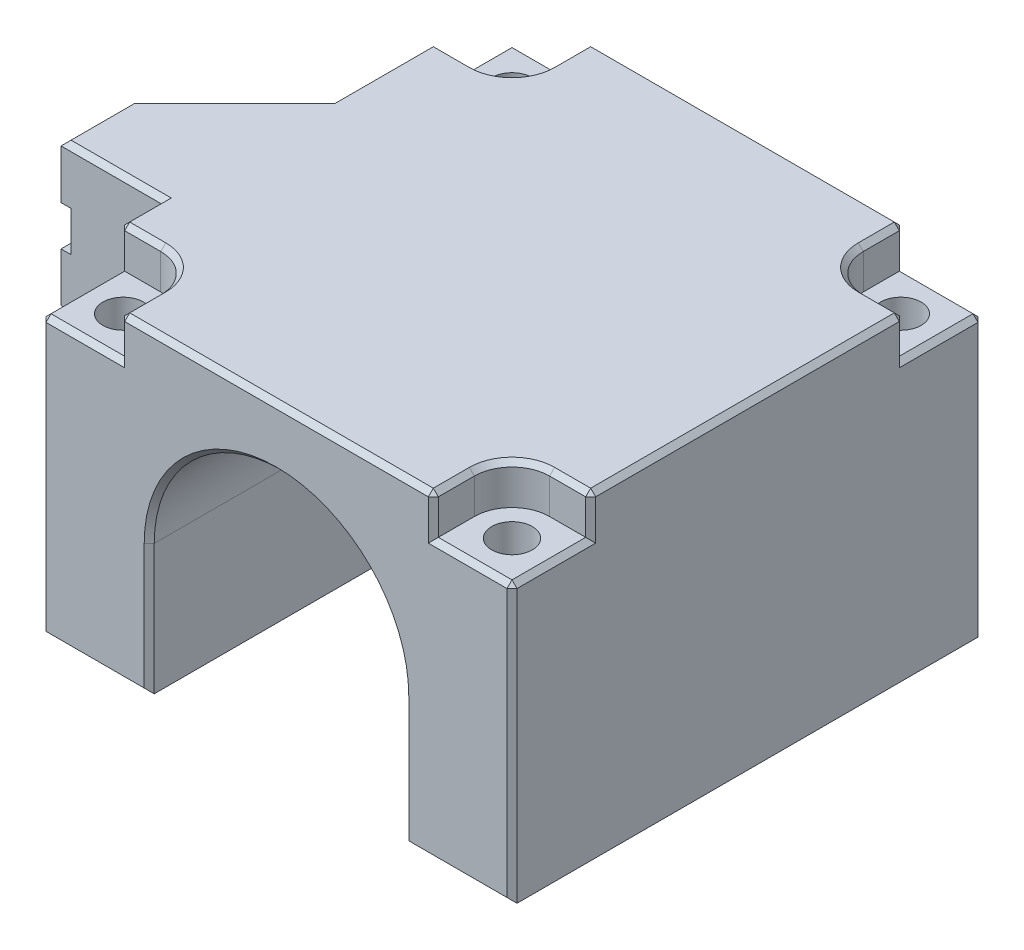
from build123d import *

# Parameters (mm, degrees)
BOSS_EXTRUDE1_DEPTH = 47
SKETCH2_R           = 2.025
CUT_EXTRUDE1_DEPTH  = 47
BOSS_EXTRUDE2_DEPTH = 10
SKETCH4_W           = 1
SKETCH4_H           = 4.000003052
SKETCH4_W_2         = 3
SKETCH4_H_2         = 4.00000763
CUT_EXTRUDE2_DEPTH  = 19
SKETCH5_W           = 7
SKETCH5_H           = 4.000003052
CUT_EXTRUDE3_DEPTH  = 10
BOSS_EXTRUDE3_START = -47
BOSS_EXTRUDE3_DEPTH = 47
SKETCH7_R           = 2.025
CUT_EXTRUDE4_DEPTH  = 43
CUT_EXTRUDE5_DEPTH  = 4
BOSS_EXTRUDE4_DEPTH = 4.400005
BOSS_EXTRUDE5_DEPTH = 0.4


with BuildPart() as part:
    # Sketch1 → Boss-Extrude1 (new body)
    with BuildSketch(Plane.XY):
        with BuildLine():
            Line((115, 94.150001526), (125.800003052, 94.150001526))
            Line((125.800003052, 94.150001526), (125.800003052, 107.150001526))
            ThreePointArc((125.800003052, 107.150001526), (138.5, 119.849998474), (151.199996948, 107.150001526))
            Line((151.199996948, 107.150001526), (151.199996948, 94.150001526))
            Line((151.199996948, 94.150001526), (162, 94.150001526))
            Line((162, 94.150001526), (162, 102.350006104))
            ThreePointArc((162, 102.350006104), (138.5, 125.850006104), (115, 102.350006104))
            Line((115, 102.350006104), (115, 94.150001526))
        make_face()
    extrude(amount=BOSS_EXTRUDE1_DEPTH)

    # Sketch2 → Cut-Extrude1 (cut)
    with BuildSketch(Plane.XZ.offset(-94.150001526)):
        with Locations(Location((119.1, 42.9, 0), (0, 0, 270))):
            Circle(SKETCH2_R)
        with Locations(Location((157.9, 42.9, 0), (0, 0, 270))):
            Circle(SKETCH2_R)
        with Locations(Location((157.9, 4.1, 0), (0, 0, 270))):
            Circle(SKETCH2_R)
        with Locations(Location((119.1, 4.1, 0), (0, 0, 270))):
            Circle(SKETCH2_R)
    extrude(amount=-CUT_EXTRUDE1_DEPTH, mode=Mode.SUBTRACT)

    # Sketch3 → Boss-Extrude2 (add)
    with BuildSketch(Plane(origin=(0, 121.450001526, 0), x_dir=(-1, 0, 0), z_dir=(0, -1, 0))):
        Polygon((-124.809127808, -8.190872192), (-105, -28), (-105, -35), (-124.809127808, -35), align=None)
    extrude(amount=BOSS_EXTRUDE2_DEPTH)

    # Sketch4 → Cut-Extrude2 (cut)
    with BuildSketch(Plane.XY.offset(35)):
        with Locations((105.5, 118.450003052)):
            Rectangle(SKETCH4_W, SKETCH4_H)
        with Locations((113.5, 118.450000763)):
            Rectangle(SKETCH4_W_2, SKETCH4_H_2)
    extrude(amount=-CUT_EXTRUDE2_DEPTH, mode=Mode.SUBTRACT)

    # Sketch5 → Cut-Extrude3 (cut)
    with BuildSketch(Plane.ZY.offset(-105)):
        with Locations((24.5, 118.450003052)):
            Rectangle(SKETCH5_W, SKETCH5_H)
    extrude(amount=-CUT_EXTRUDE3_DEPTH, mode=Mode.SUBTRACT)

    # Sketch6 → Boss-Extrude3 (add)
    with BuildSketch(Plane.XY.offset(47).offset(BOSS_EXTRUDE3_START)):
        with BuildLine():
            Line((115, 102.350006104), (115, 125.850006104))
            Line((115, 125.850006104), (162, 125.850006104))
            Line((162, 125.850006104), (162, 102.350006104))
            Line((162, 102.350006104), (151.199996948, 102.350006104))
            Line((151.199996948, 102.350006104), (151.199996948, 107.150001526))
            ThreePointArc((151.199996948, 107.150001526), (138.5, 119.849998474), (125.800003052, 107.150001526))
            Line((125.800003052, 107.150001526), (125.800003052, 102.350006104))
            Line((125.800003052, 102.350006104), (115, 102.350006104))
        make_face()
    extrude(amount=BOSS_EXTRUDE3_DEPTH)

    # Sketch7 → Cut-Extrude4 (cut)
    with BuildSketch(Plane.XZ.offset(-102.350006104)):
        with Locations(Location((119.1, 4.1, 0), (0, 0, 270))):
            Circle(SKETCH7_R)
        with Locations(Location((157.9, 4.1, 0), (0, 0, 270))):
            Circle(SKETCH7_R)
        with Locations(Location((157.9, 42.9, 0), (0, 0, 270))):
            Circle(SKETCH7_R)
        with Locations(Location((119.1, 42.9, 0), (0, 0, 270))):
            Circle(SKETCH7_R)
    extrude(amount=-CUT_EXTRUDE4_DEPTH, mode=Mode.SUBTRACT)

    # Sketch8 → Cut-Extrude5 (cut)
    with BuildSketch(Plane(origin=(0, 125.850006104, 0), x_dir=(1, 0, 0), z_dir=(0, 1, 0))):
        with BuildLine():
            Line((122.85, -4.1), (122.85, 0))
            Line((122.85, 0), (115, 0))
            Line((115, 0), (115, -7.85))
            Line((115, -7.85), (119.1, -7.85))
            ThreePointArc((119.1, -7.85), (121.751650429, -6.751650429), (122.85, -4.1))
        make_face()
        with BuildLine():
            Line((162, -7.85), (157.9, -7.85))
            ThreePointArc((157.9, -7.85), (155.248349571, -6.751650429), (154.15, -4.1))
            Line((154.15, -4.1), (154.15, 0))
            Line((154.15, 0), (162, 0))
            Line((162, 0), (162, -7.85))
        make_face()
        with BuildLine():
            Line((154.15, -42.9), (154.15, -47))
            Line((154.15, -47), (162, -47))
            Line((162, -47), (162, -39.15))
            Line((162, -39.15), (157.9, -39.15))
            ThreePointArc((157.9, -39.15), (155.248349571, -40.248349571), (154.15, -42.9))
        make_face()
        with BuildLine():
            Line((115, -39.15), (119.1, -39.15))
            ThreePointArc((119.1, -39.15), (121.751650429, -40.248349571), (122.85, -42.9))
            Line((122.85, -42.9), (122.85, -47))
            Line((122.85, -47), (115, -47))
            Line((115, -47), (115, -39.15))
        make_face()
    extrude(amount=-CUT_EXTRUDE5_DEPTH, mode=Mode.SUBTRACT)

    # Sketch10 → Boss-Extrude4 (add)
    with BuildSketch(Plane(origin=(0, 121.450001526, 0), x_dir=(1, 0, 0), z_dir=(0, 1, 0))):
        Polygon((105, -35), (115, -35), (115, -18), (105, -28), align=None)
    extrude(amount=BOSS_EXTRUDE4_DEPTH)

    # Sketch11 → Boss-Extrude5 (add)
    with BuildSketch(Plane.XZ.offset(-111.450001526)):
        Polygon((115, 18), (115, 35), (105, 35), (105, 28), align=None)
    extrude(amount=BOSS_EXTRUDE5_DEPTH)

    # Chamfer1
    # the kernel refuses this chamfer: 0.5 mm, written as the material it takes off along each edge
    with BuildSketch(Plane(origin=(123.183333333, 125.51667277, 0.333333333), x_dir=(-0.7071067811865479, 0, 0.707106781186547), z_dir=(-0.57735026918962, 0.5773502691896367, -0.5773502691896206)), Plane(origin=(115.333333333, 125.51667277, 8.183333333), x_dir=(0.7071067811865576, 0.7071067811865375, 0), z_dir=(-0.5773502691896145, 0.5773502691896308, -0.577350269189632)), Plane(origin=(123.183333333, 125.51667277, 46.666666667), x_dir=(0, 0.7071067811865475, -0.7071067811865475), z_dir=(-0.5773502691896258, 0.5773502691896258, 0.5773502691896258)), Plane(origin=(161.666666667, 125.51667277, 8.183333333), x_dir=(-0.7071067811865293, 0, -0.7071067811865657), z_dir=(0.5773502691896351, 0.577350269189637, -0.5773502691896053)), Plane(origin=(161.666666667, 125.51667277, 38.816666667), x_dir=(-0.7071067811865475, 0.7071067811865475, 0), z_dir=(0.5773502691896258, 0.5773502691896258, 0.5773502691896258)), Plane(origin=(115.333333333, 121.51667277, 0.333333333), x_dir=(-0.7071067811865488, 0, 0.7071067811865461), z_dir=(-0.5773502691896238, 0.5773502691896274, -0.577350269189626)), Plane(origin=(115.333333333, 125.51667277, 38.816666667), x_dir=(0, 0.7071067811865475, -0.7071067811865475), z_dir=(-0.5773502691896149, 0.5773502691896313, 0.5773502691896313)), Plane(origin=(161.666666667, 121.51667277, 0.333333333), x_dir=(-0.7071067811865388, 0, -0.7071067811865562), z_dir=(0.5773502691896458, 0.5773502691895998, -0.5773502691896316))) as chamfer1_piece_1:
        Polygon((-0.353553391, -0.204124145), (0.353553391, -0.204124145), (0, 0.40824829), align=None)
    extrude(amount=0.635085296, mode=Mode.SUBTRACT)
    with BuildSketch(Plane(origin=(153.816666667, 125.51667277, 0.333333333), x_dir=(0.7071067811865479, 0, 0.707106781186547), z_dir=(0.57735026918962, 0.5773502691896367, -0.5773502691896206)), Plane(origin=(153.816666667, 125.51667277, 46.666666667), x_dir=(0, 0.7071067811865475, -0.7071067811865475), z_dir=(0.5773502691896258, 0.5773502691896258, 0.5773502691896258)), Plane(origin=(115.333333333, 121.51667277, 46.666666667), x_dir=(-0.7071067811865576, 0, -0.7071067811865375), z_dir=(-0.5773502691896149, 0.5773502691896313, 0.5773502691896313)), Plane(origin=(161.666666667, 121.51667277, 46.666666667), x_dir=(-0.7071067811865475, 0, 0.7071067811865475), z_dir=(0.5773502691896258, 0.5773502691896258, 0.5773502691896258))) as chamfer1_piece_2:
        Polygon((-0.353553391, 0.204124145), (0.353553391, 0.204124145), (0, -0.40824829), align=None)
    extrude(amount=0.635085296, mode=Mode.SUBTRACT)
    with BuildSketch(Plane(origin=(138.5, 107.150001526, 0), x_dir=(-1, 0, 0), z_dir=(0, -1, 0))) as chamfer1_piece_3:
        with BuildLine():
            Line((12.685854813, -0.514142136), (13.214139084, 0.014142136))
            Line((13.214139084, 0.014142136), (13.214139084, 0.024142136))
            ThreePointArc((13.214139084, 0.024142136), (12.957068016, 0.01), (12.699996948, 0.01))
            Line((12.699996948, 0.01), (12.689996948, 0))
            ThreePointArc((12.689996948, 0), (12.689996948, -0.257071068), (12.675854813, -0.514142136))
            Line((12.675854813, -0.514142136), (12.685854813, -0.514142136))
        make_face()
    revolve(axis=Axis((138.5, 107.150001526, 0), (0, 0, -1)), revolution_arc=180, mode=Mode.SUBTRACT)
    with BuildSketch(Plane(origin=(125.800003052, 107.150001526, 0), x_dir=(0.027495876610582164, -1.0927293716429358e-15, 0.9996219169112968), z_dir=(0, -1, 0)), Plane(origin=(125.800003052, 92.864160032, 47), x_dir=(0.02749587661058229, 0, -0.9996219169112968), z_dir=(0, 1, 0)), Plane(origin=(151.199996948, 107.150001526, 47), x_dir=(-0.02749587661058229, 0, -0.9996219169112968), z_dir=(0, -1, 0)), Plane(origin=(151.199996948, 92.864160032, 0), x_dir=(-0.027495876610582174, -1.092729371642936e-15, 0.9996219169112968), z_dir=(0, 1, 0))) as chamfer1_piece_4:
        with BuildLine():
            Line((0.514336598, 0), (-0.028273577, 0.513558897))
            Line((-0.028273577, 0.513558897), (-0.038269797, 0.513283938))
            ThreePointArc((-0.038269797, 0.513283938), (-0.017064614, 0.256698915), (-0.009996219, -0.000274959))
            Line((-0.009996219, -0.000274959), (0.000274959, -0.009996219))
            ThreePointArc((0.000274959, -0.009996219), (0.257248832, -0.002927825), (0.514611556, -0.009996219))
            Line((0.514611556, -0.009996219), (0.514336598, 0))
        make_face()
    extrude(amount=14.285841494, mode=Mode.SUBTRACT)
    with BuildSketch(Plane(origin=(113.714158506, 94.150001526, 0), x_dir=(0, -0.027495876610582174, 0.9996219169112968), z_dir=(1, 0, 0)), Plane(origin=(149.914155454, 94.150001526, 0), x_dir=(0, -0.027495876610582174, 0.9996219169112968), z_dir=(1, 0, 0))) as chamfer1_piece_5:
        with BuildLine():
            Line((0.514336598, 0), (-0.028273577, -0.513558897))
            Line((-0.028273577, -0.513558897), (-0.038269797, -0.513283938))
            ThreePointArc((-0.038269797, -0.513283938), (-0.017064614, -0.256698915), (-0.009996219, 0.000274959))
            Line((-0.009996219, 0.000274959), (0.000274959, 0.009996219))
            ThreePointArc((0.000274959, 0.009996219), (0.257248832, 0.002927825), (0.514611556, 0.009996219))
            Line((0.514611556, 0.009996219), (0.514336598, 0))
        make_face()
    extrude(amount=13.37168604, mode=Mode.SUBTRACT)
    with BuildSketch(Plane(origin=(138.5, 107.150001526, 47), x_dir=(-1, 0, 0), z_dir=(0, -1, 0))) as chamfer1_piece_6:
        with BuildLine():
            Line((12.685854813, 0.514142136), (13.214139084, -0.014142136))
            Line((13.214139084, -0.014142136), (13.214139084, -0.024142136))
            ThreePointArc((13.214139084, -0.024142136), (12.957068016, -0.01), (12.699996948, -0.01))
            Line((12.699996948, -0.01), (12.689996948, 0))
            ThreePointArc((12.689996948, 0), (12.689996948, 0.257071068), (12.675854813, 0.514142136))
            Line((12.675854813, 0.514142136), (12.685854813, 0.514142136))
        make_face()
    revolve(axis=Axis((138.5, 107.150001526, 47), (0, 0, -1)), revolution_arc=180, mode=Mode.SUBTRACT)
    with BuildSketch(Plane(origin=(121.564158506, 125.850006104, 0), x_dir=(0, 0.027495876610582174, 0.9996219169112968), z_dir=(1, 0, 0)), Plane(origin=(155.435841494, 125.850006104, 47), x_dir=(0, 0.02749587661058229, -0.9996219169112968), z_dir=(-1, 0, 0)), Plane(origin=(162, 125.850006104, 6.564158506), x_dir=(-0.999621916911297, 0.027495876610582292, 0), z_dir=(0, 0, 1))) as chamfer1_piece_7:
        with BuildLine():
            Line((0.514336598, 0), (-0.028273577, 0.513558897))
            Line((-0.028273577, 0.513558897), (-0.038269797, 0.513283938))
            ThreePointArc((-0.038269797, 0.513283938), (-0.017064614, 0.256698915), (-0.009996219, -0.000274959))
            Line((-0.009996219, -0.000274959), (0.000274959, -0.009996219))
            ThreePointArc((0.000274959, -0.009996219), (0.257248832, -0.002927825), (0.514611556, -0.009996219))
            Line((0.514611556, -0.009996219), (0.514336598, 0))
        make_face()
    extrude(amount=33.871682988, mode=Mode.SUBTRACT)
    with BuildSketch(Plane(origin=(115, 125.850006104, 6.564158506), x_dir=(0.999621916911297, 0.027495876610582292, 0), z_dir=(0, 0, 1))) as chamfer1_piece_8_section:
        with BuildLine():
            Line((0.514336598, 0), (-0.028273577, -0.513558897))
            Line((-0.028273577, -0.513558897), (-0.038269797, -0.513283938))
            ThreePointArc((-0.038269797, -0.513283938), (-0.017064614, -0.256698915), (-0.009996219, 0.000274959))
            Line((-0.009996219, 0.000274959), (0.000274959, 0.009996219))
            ThreePointArc((0.000274959, 0.009996219), (0.257248832, 0.002927825), (0.514611556, 0.009996219))
            Line((0.514611556, 0.009996219), (0.514336598, 0))
        make_face()
    chamfer1_piece_8 = extrude(amount=12.721682988, mode=Mode.PRIVATE)
    chamfer1_piece_8 = split(chamfer1_piece_8, bisect_by=Plane(origin=(117.981576575, 125.684356276, 15.018423425), z_dir=(-0.7071067811865476, 0, -0.7071067811865476)), keep=Keep.TOP, mode=Mode.PRIVATE)
    add(chamfer1_piece_8, mode=Mode.SUBTRACT)
    with BuildSketch(Plane(origin=(115, 123.135847597, 0), x_dir=(0.9996219169112968, 0, -0.027495876610586483), z_dir=(0, -1, 0)), Plane(origin=(115, 92.864160032, 47), x_dir=(0.999621916911297, 0, 0.027495876610582292), z_dir=(0, 1, 0)), Plane(origin=(162, 92.864160032, 47), x_dir=(0.02749587661058229, 0, -0.9996219169112968), z_dir=(0, 1, 0)), Plane(origin=(162, 123.135847597, 0), x_dir=(0.027495876610582174, 0, 0.9996219169112968), z_dir=(0, -1, 0))) as chamfer1_piece_9:
        with BuildLine():
            Line((0.514336598, 0), (-0.028273577, 0.513558897))
            Line((-0.028273577, 0.513558897), (-0.038269797, 0.513283938))
            ThreePointArc((-0.038269797, 0.513283938), (-0.017064614, 0.256698915), (-0.009996219, -0.000274959))
            Line((-0.009996219, -0.000274959), (0.000274959, -0.009996219))
            ThreePointArc((0.000274959, -0.009996219), (0.257248832, -0.002927825), (0.514611556, -0.009996219))
            Line((0.514611556, -0.009996219), (0.514336598, 0))
        make_face()
    extrude(amount=30.271687566, mode=Mode.SUBTRACT)
    with BuildSketch(Plane(origin=(119.1, 125.850006104, 42.9), x_dir=(0, 0, -1), z_dir=(-1, 0, 0))) as chamfer1_piece_10:
        with BuildLine():
            Line((4.264142136, -0.014142136), (3.735857864, 0.514142136))
            Line((3.735857864, 0.514142136), (3.725857864, 0.514142136))
            ThreePointArc((3.725857864, 0.514142136), (3.74, 0.257071068), (3.74, 0))
            Line((3.74, 0), (3.75, -0.01))
            ThreePointArc((3.75, -0.01), (4.007071068, -0.01), (4.264142136, -0.024142136))
            Line((4.264142136, -0.024142136), (4.264142136, -0.014142136))
        make_face()
    revolve(axis=Axis((119.1, 125.850006104, 42.9), (0, -1, 0)), revolution_arc=90, mode=Mode.SUBTRACT)
    with BuildSketch(Plane(origin=(113.714158506, 125.850006104, 39.15), x_dir=(0, 0.02749587661058229, -0.9996219169112968), z_dir=(1, 0, 0)), Plane(origin=(122.85, 125.850006104, 42.9), x_dir=(0.999621916911297, 0.027495876610582292, 0), z_dir=(0, 0, 1)), Plane(origin=(163.285841494, 125.850006104, 7.85), x_dir=(0, 0.027495876610582247, 0.999621916911297), z_dir=(-1, 0, 0)), Plane(origin=(154.15, 125.850006104, 4.1), x_dir=(-0.999621916911297, 0.027495876610582292, 0), z_dir=(0, 0, -1)), Plane(origin=(122.85, 125.850006104, 4.1), x_dir=(-0.02749587661058229, -0.9996219169112968, 0), z_dir=(0, 0, -1))) as chamfer1_piece_11:
        with BuildLine():
            Line((0.514336598, 0), (-0.028273577, -0.513558897))
            Line((-0.028273577, -0.513558897), (-0.038269797, -0.513283938))
            ThreePointArc((-0.038269797, -0.513283938), (-0.017064614, -0.256698915), (-0.009996219, 0.000274959))
            Line((-0.009996219, 0.000274959), (0.000274959, 0.009996219))
            ThreePointArc((0.000274959, 0.009996219), (0.257248832, 0.002927825), (0.514611556, 0.009996219))
            Line((0.514611556, 0.009996219), (0.514336598, 0))
        make_face()
    extrude(amount=5.385841494, mode=Mode.SUBTRACT)
    with BuildSketch(Plane(origin=(122.85, 121.850006104, 47), x_dir=(0, 0.02749587661058229, -0.9996219169112968), z_dir=(-1, 0, 0)), Plane(origin=(115, 121.850006104, 48.285841494), x_dir=(0.999621916911297, 0.027495876610582292, 0), z_dir=(0, 0, -1)), Plane(origin=(154.15, 121.850006104, 0), x_dir=(0, 0.027495876610582174, 0.9996219169112968), z_dir=(1, 0, 0)), Plane(origin=(162, 121.850006104, -1.285841494), x_dir=(-0.999621916911297, 0.027495876610582292, 0), z_dir=(0, 0, 1))) as chamfer1_piece_12:
        with BuildLine():
            Line((0.514336598, 0), (-0.028273577, 0.513558897))
            Line((-0.028273577, 0.513558897), (-0.038269797, 0.513283938))
            ThreePointArc((-0.038269797, 0.513283938), (-0.017064614, 0.256698915), (-0.009996219, -0.000274959))
            Line((-0.009996219, -0.000274959), (0.000274959, -0.009996219))
            ThreePointArc((0.000274959, -0.009996219), (0.257248832, -0.002927825), (0.514611556, -0.009996219))
            Line((0.514611556, -0.009996219), (0.514336598, 0))
        make_face()
    extrude(amount=9.135841494, mode=Mode.SUBTRACT)
    with BuildSketch(Plane(origin=(122.85, 127.135847597, 47), x_dir=(-0.02749587661058229, 0, -0.9996219169112968), z_dir=(0, -1, 0)), Plane(origin=(162, 127.135847597, 39.15), x_dir=(-0.999621916911297, 0, 0.027495876610582292), z_dir=(0, -1, 0)), Plane(origin=(154.15, 127.135847597, 0), x_dir=(0.027495876610582174, 0, 0.9996219169112968), z_dir=(0, -1, 0)), Plane(origin=(162, 127.135847597, 7.85), x_dir=(0.027495876610582247, 0, 0.999621916911297), z_dir=(0, -1, 0)), Plane(origin=(115, 127.135847597, 7.85), x_dir=(0.9996219169112968, 0, -0.02749587661058574), z_dir=(0, -1, 0))) as chamfer1_piece_13:
        with BuildLine():
            Line((0.514336598, 0), (-0.028273577, 0.513558897))
            Line((-0.028273577, 0.513558897), (-0.038269797, 0.513283938))
            ThreePointArc((-0.038269797, 0.513283938), (-0.017064614, 0.256698915), (-0.009996219, -0.000274959))
            Line((-0.009996219, -0.000274959), (0.000274959, -0.009996219))
            ThreePointArc((0.000274959, -0.009996219), (0.257248832, -0.002927825), (0.514611556, -0.009996219))
            Line((0.514611556, -0.009996219), (0.514336598, 0))
        make_face()
    extrude(amount=5.285841494, mode=Mode.SUBTRACT)
    with BuildSketch(Plane(origin=(115, 127.135847597, 39.15), x_dir=(0.999621916911297, 0, 0.027495876610582292), z_dir=(0, -1, 0)), Plane(origin=(154.15, 127.135847597, 47), x_dir=(0.02749587661058229, 0, -0.9996219169112968), z_dir=(0, -1, 0)), Plane(origin=(122.85, 127.135847597, 0), x_dir=(-0.027495876610582174, 0, 0.9996219169112968), z_dir=(0, -1, 0))) as chamfer1_piece_14:
        with BuildLine():
            Line((0.514336598, 0), (-0.028273577, -0.513558897))
            Line((-0.028273577, -0.513558897), (-0.038269797, -0.513283938))
            ThreePointArc((-0.038269797, -0.513283938), (-0.017064614, -0.256698915), (-0.009996219, 0.000274959))
            Line((-0.009996219, 0.000274959), (0.000274959, 0.009996219))
            ThreePointArc((0.000274959, 0.009996219), (0.257248832, 0.002927825), (0.514611556, 0.009996219))
            Line((0.514611556, 0.009996219), (0.514336598, 0))
        make_face()
    extrude(amount=5.285841494, mode=Mode.SUBTRACT)
    with BuildSketch(Plane(origin=(157.9, 125.850006104, 42.9), x_dir=(0, 0, -1), z_dir=(1, 0, 0))) as chamfer1_piece_15:
        with BuildLine():
            Line((4.264142136, 0.014142136), (3.735857864, -0.514142136))
            Line((3.735857864, -0.514142136), (3.725857864, -0.514142136))
            ThreePointArc((3.725857864, -0.514142136), (3.74, -0.257071068), (3.74, 0))
            Line((3.74, 0), (3.75, 0.01))
            ThreePointArc((3.75, 0.01), (4.007071068, 0.01), (4.264142136, 0.024142136))
            Line((4.264142136, 0.024142136), (4.264142136, 0.014142136))
        make_face()
    revolve(axis=Axis((157.9, 125.850006104, 42.9), (0, 1, 0)), revolution_arc=90, mode=Mode.SUBTRACT)
    with BuildSketch(Plane(origin=(154.15, 125.850006104, 42.9), x_dir=(-0.999621916911297, 0.027495876610582292, 0), z_dir=(0, 0, 1)), Plane(origin=(163.285841494, 125.850006104, 39.15), x_dir=(0, 0.02749587661058229, -0.9996219169112968), z_dir=(-1, 0, 0)), Plane(origin=(113.714158506, 125.850006104, 7.85), x_dir=(0, 0.027495876610582247, 0.999621916911297), z_dir=(1, 0, 0))) as chamfer1_piece_16:
        with BuildLine():
            Line((0.514336598, 0), (-0.028273577, 0.513558897))
            Line((-0.028273577, 0.513558897), (-0.038269797, 0.513283938))
            ThreePointArc((-0.038269797, 0.513283938), (-0.017064614, 0.256698915), (-0.009996219, -0.000274959))
            Line((-0.009996219, -0.000274959), (0.000274959, -0.009996219))
            ThreePointArc((0.000274959, -0.009996219), (0.257248832, -0.002927825), (0.514611556, -0.009996219))
            Line((0.514611556, -0.009996219), (0.514336598, 0))
        make_face()
    extrude(amount=5.385841494, mode=Mode.SUBTRACT)
    with BuildSketch(Plane(origin=(162, 121.850006104, 48.285841494), x_dir=(-0.999621916911297, 0.027495876610582292, 0), z_dir=(0, 0, -1)), Plane(origin=(154.15, 121.850006104, 47), x_dir=(0, 0.02749587661058229, -0.9996219169112968), z_dir=(1, 0, 0)), Plane(origin=(115, 121.850006104, -1.285841494), x_dir=(0.999621916911297, 0.027495876610582292, 0), z_dir=(0, 0, 1)), Plane(origin=(122.85, 121.850006104, 0), x_dir=(0, 0.027495876610582174, 0.9996219169112968), z_dir=(-1, 0, 0))) as chamfer1_piece_17:
        with BuildLine():
            Line((0.514336598, 0), (-0.028273577, -0.513558897))
            Line((-0.028273577, -0.513558897), (-0.038269797, -0.513283938))
            ThreePointArc((-0.038269797, -0.513283938), (-0.017064614, -0.256698915), (-0.009996219, 0.000274959))
            Line((-0.009996219, 0.000274959), (0.000274959, 0.009996219))
            ThreePointArc((0.000274959, 0.009996219), (0.257248832, 0.002927825), (0.514611556, 0.009996219))
            Line((0.514611556, 0.009996219), (0.514336598, 0))
        make_face()
    extrude(amount=9.135841494, mode=Mode.SUBTRACT)
    with BuildSketch(Plane(origin=(157.9, 125.850006104, 4.1), x_dir=(0, 0, 1), z_dir=(1, 0, 0))) as chamfer1_piece_18:
        with BuildLine():
            Line((4.264142136, -0.014142136), (3.735857864, 0.514142136))
            Line((3.735857864, 0.514142136), (3.725857864, 0.514142136))
            ThreePointArc((3.725857864, 0.514142136), (3.74, 0.257071068), (3.74, 0))
            Line((3.74, 0), (3.75, -0.01))
            ThreePointArc((3.75, -0.01), (4.007071068, -0.01), (4.264142136, -0.024142136))
            Line((4.264142136, -0.024142136), (4.264142136, -0.014142136))
        make_face()
    revolve(axis=Axis((157.9, 125.850006104, 4.1), (0, -1, 0)), revolution_arc=90, mode=Mode.SUBTRACT)
    with BuildSketch(Plane(origin=(119.1, 125.850006104, 4.1), x_dir=(0, 0, 1), z_dir=(-1, 0, 0))) as chamfer1_piece_19:
        with BuildLine():
            Line((4.264142136, 0.014142136), (3.735857864, -0.514142136))
            Line((3.735857864, -0.514142136), (3.725857864, -0.514142136))
            ThreePointArc((3.725857864, -0.514142136), (3.74, -0.257071068), (3.74, 0))
            Line((3.74, 0), (3.75, 0.01))
            ThreePointArc((3.75, 0.01), (4.007071068, 0.01), (4.264142136, 0.024142136))
            Line((4.264142136, 0.024142136), (4.264142136, 0.014142136))
        make_face()
    revolve(axis=Axis((119.1, 125.850006104, 4.1), (0, 1, 0)), revolution_arc=90, mode=Mode.SUBTRACT)
    with BuildSketch(Plane(origin=(149.914155454, 94.150001526, 47), x_dir=(0, -0.02749587661058229, -0.9996219169112968), z_dir=(1, 0, 0)), Plane(origin=(113.714158506, 94.150001526, 47), x_dir=(0, -0.02749587661058229, -0.9996219169112968), z_dir=(1, 0, 0))) as chamfer1_piece_20:
        with BuildLine():
            Line((0.514336598, 0), (-0.028273577, 0.513558897))
            Line((-0.028273577, 0.513558897), (-0.038269797, 0.513283938))
            ThreePointArc((-0.038269797, 0.513283938), (-0.017064614, 0.256698915), (-0.009996219, -0.000274959))
            Line((-0.009996219, -0.000274959), (0.000274959, -0.009996219))
            ThreePointArc((0.000274959, -0.009996219), (0.257248832, -0.002927825), (0.514611556, -0.009996219))
            Line((0.514611556, -0.009996219), (0.514336598, 0))
        make_face()
    extrude(amount=13.37168604, mode=Mode.SUBTRACT)
    with BuildSketch(Plane(origin=(115, 125.850006104, 35), x_dir=(0.999621916911297, 0.027495876610582292, 0), z_dir=(0, 0, 1))) as chamfer1_piece_21:
        with BuildLine():
            Line((0.514336598, 0), (-0.028273577, -0.513558897))
            Line((-0.028273577, -0.513558897), (-0.038269797, -0.513283938))
            ThreePointArc((-0.038269797, -0.513283938), (-0.017064614, -0.256698915), (-0.009996219, 0.000274959))
            Line((-0.009996219, 0.000274959), (0.000274959, 0.009996219))
            ThreePointArc((0.000274959, 0.009996219), (0.257248832, 0.002927825), (0.514611556, 0.009996219))
            Line((0.514611556, 0.009996219), (0.514336598, 0))
        make_face()
    extrude(amount=5.435841494, mode=Mode.SUBTRACT)
    with BuildSketch(Plane(origin=(105, 125.850006526, 26.714158506), x_dir=(0.999621916911297, 0.027495876610582292, 0), z_dir=(0, 0, 1)), Plane(origin=(105, 111.050001526, 36.285841494), x_dir=(0.999621916911297, -0.027495876610582292, 0), z_dir=(0, 0, -1))) as chamfer1_piece_22:
        with BuildLine():
            Line((0.514336598, 0), (-0.028273577, -0.513558897))
            Line((-0.028273577, -0.513558897), (-0.038269797, -0.513283938))
            ThreePointArc((-0.038269797, -0.513283938), (-0.017064614, -0.256698915), (-0.009996219, 0.000274959))
            Line((-0.009996219, 0.000274959), (0.000274959, 0.009996219))
            ThreePointArc((0.000274959, 0.009996219), (0.257248832, 0.002927825), (0.514611556, 0.009996219))
            Line((0.514611556, 0.009996219), (0.514336598, 0))
        make_face()
    extrude(amount=9.571682988, mode=Mode.SUBTRACT)
    with BuildSketch(Plane(origin=(103.714158506, 125.850006526, 35), x_dir=(0, 0.02749587661058229, -0.9996219169112968), z_dir=(1, 0, 0)), Plane(origin=(115, 111.050001526, 35), x_dir=(0, -0.02749587661058229, -0.9996219169112968), z_dir=(-1, 0, 0))) as chamfer1_piece_23:
        with BuildLine():
            Line((0.514336598, 0), (-0.028273577, -0.513558897))
            Line((-0.028273577, -0.513558897), (-0.038269797, -0.513283938))
            ThreePointArc((-0.038269797, -0.513283938), (-0.017064614, -0.256698915), (-0.009996219, 0.000274959))
            Line((-0.009996219, 0.000274959), (0.000274959, 0.009996219))
            ThreePointArc((0.000274959, 0.009996219), (0.257248832, 0.002927825), (0.514611556, 0.009996219))
            Line((0.514611556, 0.009996219), (0.514336598, 0))
        make_face()
    extrude(amount=11.285841494, mode=Mode.SUBTRACT)
    with BuildSketch(Plane(origin=(115.90922724, 125.850006526, 17.09077276), x_dir=(0.7068394360706737, 0.02749587661058184, 0.7068394360706735), z_dir=(-0.7071067811865475, 0, 0.7071067811865477))) as chamfer1_piece_24_section:
        with BuildLine():
            Line((0.514336598, 0), (-0.028273577, -0.513558897))
            Line((-0.028273577, -0.513558897), (-0.038269797, -0.513283938))
            ThreePointArc((-0.038269797, -0.513283938), (-0.017064614, -0.256698915), (-0.009996219, 0.000274959))
            Line((-0.009996219, 0.000274959), (0.000274959, 0.009996219))
            ThreePointArc((0.000274959, 0.009996219), (0.257248832, 0.002927825), (0.514611556, 0.009996219))
            Line((0.514611556, 0.009996219), (0.514336598, 0))
        make_face()
    chamfer1_piece_24 = extrude(amount=16.713818612, mode=Mode.PRIVATE)
    chamfer1_piece_24 = split(chamfer1_piece_24, bisect_by=Plane(origin=(115, 125.684553653, 23.628409874), z_dir=(-1, 0, 0)), keep=Keep.TOP, mode=Mode.PRIVATE)
    add(chamfer1_piece_24, mode=Mode.SUBTRACT)
    with BuildSketch(Plane(origin=(104.09077276, 111.050001526, 28.90922724), x_dir=(-0.01944252080602078, 0.9996219169112965, -0.019442520806020772), z_dir=(0.7071067811865475, 0, -0.7071067811865477))) as chamfer1_piece_25_section:
        with BuildLine():
            Line((0.514336598, 0), (-0.028273577, 0.513558897))
            Line((-0.028273577, 0.513558897), (-0.038269797, 0.513283938))
            ThreePointArc((-0.038269797, 0.513283938), (-0.017064614, 0.256698915), (-0.009996219, -0.000274959))
            Line((-0.009996219, -0.000274959), (0.000274959, -0.009996219))
            ThreePointArc((0.000274959, -0.009996219), (0.257248832, -0.002927825), (0.514611556, -0.009996219))
            Line((0.514611556, -0.009996219), (0.514336598, 0))
        make_face()
    chamfer1_piece_25 = extrude(amount=16.713818612, mode=Mode.PRIVATE)
    chamfer1_piece_25 = split(chamfer1_piece_25, bisect_by=Plane(origin=(115, 111.215454399, 23.628409875), z_dir=(-1, 0, 0)), keep=Keep.TOP, mode=Mode.PRIVATE)
    add(chamfer1_piece_25, mode=Mode.SUBTRACT)
    with BuildSketch(Plane(origin=(115, 125.850006104, 6.564158506), x_dir=(0.999621916911297, 0.027495876610582292, 0), z_dir=(0, 0, 1))) as chamfer1_piece_26a_section:
        with BuildLine():
            Line((0.514336598, 0), (-0.028273577, -0.513558897))
            Line((-0.028273577, -0.513558897), (-0.038269797, -0.513283938))
            ThreePointArc((-0.038269797, -0.513283938), (-0.017064614, -0.256698915), (-0.009996219, 0.000274959))
            Line((-0.009996219, 0.000274959), (0.000274959, 0.009996219))
            ThreePointArc((0.000274959, 0.009996219), (0.257248832, 0.002927825), (0.514611556, 0.009996219))
            Line((0.514611556, 0.009996219), (0.514336598, 0))
        make_face()
    chamfer1_piece_26a = extrude(amount=12.721682988, mode=Mode.PRIVATE)
    chamfer1_piece_26a = split(chamfer1_piece_26a, bisect_by=Plane(origin=(114.810419593, 125.690959541, 18.189580407), z_dir=(0.7071067811865476, 0, 0.7071067811865476)), keep=Keep.TOP, mode=Mode.PRIVATE)
    with BuildSketch(Plane(origin=(115.90922724, 125.850006526, 17.09077276), x_dir=(0.7068394360706737, 0.02749587661058184, 0.7068394360706735), z_dir=(-0.7071067811865475, 0, 0.7071067811865477))) as chamfer1_piece_26b_section:
        with BuildLine():
            Line((0.514336598, 0), (-0.028273577, -0.513558897))
            Line((-0.028273577, -0.513558897), (-0.038269797, -0.513283938))
            ThreePointArc((-0.038269797, -0.513283938), (-0.017064614, -0.256698915), (-0.009996219, 0.000274959))
            Line((-0.009996219, 0.000274959), (0.000274959, 0.009996219))
            ThreePointArc((0.000274959, 0.009996219), (0.257248832, 0.002927825), (0.514611556, 0.009996219))
            Line((0.514611556, 0.009996219), (0.514336598, 0))
        make_face()
    chamfer1_piece_26b = extrude(amount=16.713818612, mode=Mode.PRIVATE)
    chamfer1_piece_26b = split(chamfer1_piece_26b, bisect_by=Plane(origin=(115, 125.690959964, 17.731892818), z_dir=(1, 0, 0)), keep=Keep.TOP, mode=Mode.PRIVATE)
    chamfer1_piece_26 = chamfer1_piece_26a & chamfer1_piece_26b
    add(chamfer1_piece_26, mode=Mode.SUBTRACT)
    with BuildSketch(Plane(origin=(124.135841494, 121.850006104, 47), x_dir=(0, 0.02749587661058229, -0.9996219169112968), z_dir=(-1, 0, 0))) as chamfer1_piece_27a_section:
        with BuildLine():
            Line((0.514336598, 0), (-0.028273577, 0.513558897))
            Line((-0.028273577, 0.513558897), (-0.038269797, 0.513283938))
            ThreePointArc((-0.038269797, 0.513283938), (-0.017064614, 0.256698915), (-0.009996219, -0.000274959))
            Line((-0.009996219, -0.000274959), (0.000274959, -0.009996219))
            ThreePointArc((0.000274959, -0.009996219), (0.257248832, -0.002927825), (0.514611556, -0.009996219))
            Line((0.514611556, -0.009996219), (0.514336598, 0))
        make_face()
    chamfer1_piece_27a = extrude(amount=10.421682988, mode=Mode.PRIVATE)
    chamfer1_piece_27a = split(chamfer1_piece_27a, bisect_by=Plane(origin=(122.85, 121.68510929, 46.835103187), z_dir=(1, 0, 0)), keep=Keep.TOP, mode=Mode.PRIVATE)
    with BuildSketch(Plane(origin=(122.85, 127.135847597, 47), x_dir=(-0.02749587661058229, 0, -0.9996219169112968), z_dir=(0, -1, 0))) as chamfer1_piece_27b_section:
        with BuildLine():
            Line((0.514336598, 0), (-0.028273577, 0.513558897))
            Line((-0.028273577, 0.513558897), (-0.038269797, 0.513283938))
            ThreePointArc((-0.038269797, 0.513283938), (-0.017064614, 0.256698915), (-0.009996219, -0.000274959))
            Line((-0.009996219, -0.000274959), (0.000274959, -0.009996219))
            ThreePointArc((0.000274959, -0.009996219), (0.257248832, -0.002927825), (0.514611556, -0.009996219))
            Line((0.514611556, -0.009996219), (0.514336598, 0))
        make_face()
    chamfer1_piece_27b = extrude(amount=6.571682988, mode=Mode.PRIVATE)
    chamfer1_piece_27b = split(chamfer1_piece_27b, bisect_by=Plane(origin=(123.014896813, 121.850006104, 46.835103187), z_dir=(0, -1, 0)), keep=Keep.TOP, mode=Mode.PRIVATE)
    chamfer1_piece_27 = chamfer1_piece_27a & chamfer1_piece_27b
    add(chamfer1_piece_27, mode=Mode.SUBTRACT)
    with BuildSketch(Plane(origin=(115, 127.135847597, 39.15), x_dir=(0.999621916911297, 0, 0.027495876610582292), z_dir=(0, -1, 0))) as chamfer1_piece_28a_section:
        with BuildLine():
            Line((0.514336598, 0), (-0.028273577, -0.513558897))
            Line((-0.028273577, -0.513558897), (-0.038269797, -0.513283938))
            ThreePointArc((-0.038269797, -0.513283938), (-0.017064614, -0.256698915), (-0.009996219, 0.000274959))
            Line((-0.009996219, 0.000274959), (0.000274959, 0.009996219))
            ThreePointArc((0.000274959, 0.009996219), (0.257248832, 0.002927825), (0.514611556, 0.009996219))
            Line((0.514611556, 0.009996219), (0.514336598, 0))
        make_face()
    chamfer1_piece_28a = extrude(amount=6.571682988, mode=Mode.PRIVATE)
    chamfer1_piece_28a = split(chamfer1_piece_28a, bisect_by=Plane(origin=(115.164896813, 121.850006104, 38.985103187), z_dir=(0, -1, 0)), keep=Keep.TOP, mode=Mode.PRIVATE)
    with BuildSketch(Plane(origin=(115, 121.850006104, 48.285841494), x_dir=(0.999621916911297, 0.027495876610582292, 0), z_dir=(0, 0, -1))) as chamfer1_piece_28b_section:
        with BuildLine():
            Line((0.514336598, 0), (-0.028273577, 0.513558897))
            Line((-0.028273577, 0.513558897), (-0.038269797, 0.513283938))
            ThreePointArc((-0.038269797, 0.513283938), (-0.017064614, 0.256698915), (-0.009996219, -0.000274959))
            Line((-0.009996219, -0.000274959), (0.000274959, -0.009996219))
            ThreePointArc((0.000274959, -0.009996219), (0.257248832, -0.002927825), (0.514611556, -0.009996219))
            Line((0.514611556, -0.009996219), (0.514336598, 0))
        make_face()
    chamfer1_piece_28b = extrude(amount=10.421682988, mode=Mode.PRIVATE)
    chamfer1_piece_28b = split(chamfer1_piece_28b, bisect_by=Plane(origin=(115.164896813, 121.68510929, 39.15), z_dir=(0, 0, -1)), keep=Keep.TOP, mode=Mode.PRIVATE)
    chamfer1_piece_28 = chamfer1_piece_28a & chamfer1_piece_28b
    add(chamfer1_piece_28, mode=Mode.SUBTRACT)
    with BuildSketch(Plane(origin=(162, 121.850006104, 48.285841494), x_dir=(-0.999621916911297, 0.027495876610582292, 0), z_dir=(0, 0, -1))) as chamfer1_piece_29a_section:
        with BuildLine():
            Line((0.514336598, 0), (-0.028273577, -0.513558897))
            Line((-0.028273577, -0.513558897), (-0.038269797, -0.513283938))
            ThreePointArc((-0.038269797, -0.513283938), (-0.017064614, -0.256698915), (-0.009996219, 0.000274959))
            Line((-0.009996219, 0.000274959), (0.000274959, 0.009996219))
            ThreePointArc((0.000274959, 0.009996219), (0.257248832, 0.002927825), (0.514611556, 0.009996219))
            Line((0.514611556, 0.009996219), (0.514336598, 0))
        make_face()
    chamfer1_piece_29a = extrude(amount=10.421682988, mode=Mode.PRIVATE)
    chamfer1_piece_29a = split(chamfer1_piece_29a, bisect_by=Plane(origin=(161.835103187, 121.68510929, 39.15), z_dir=(0, 0, -1)), keep=Keep.TOP, mode=Mode.PRIVATE)
    with BuildSketch(Plane(origin=(162, 127.135847597, 39.15), x_dir=(-0.999621916911297, 0, 0.027495876610582292), z_dir=(0, -1, 0))) as chamfer1_piece_29b_section:
        with BuildLine():
            Line((0.514336598, 0), (-0.028273577, 0.513558897))
            Line((-0.028273577, 0.513558897), (-0.038269797, 0.513283938))
            ThreePointArc((-0.038269797, 0.513283938), (-0.017064614, 0.256698915), (-0.009996219, -0.000274959))
            Line((-0.009996219, -0.000274959), (0.000274959, -0.009996219))
            ThreePointArc((0.000274959, -0.009996219), (0.257248832, -0.002927825), (0.514611556, -0.009996219))
            Line((0.514611556, -0.009996219), (0.514336598, 0))
        make_face()
    chamfer1_piece_29b = extrude(amount=6.571682988, mode=Mode.PRIVATE)
    chamfer1_piece_29b = split(chamfer1_piece_29b, bisect_by=Plane(origin=(161.835103187, 121.850006104, 38.985103187), z_dir=(0, -1, 0)), keep=Keep.TOP, mode=Mode.PRIVATE)
    chamfer1_piece_29 = chamfer1_piece_29a & chamfer1_piece_29b
    add(chamfer1_piece_29, mode=Mode.SUBTRACT)
    with BuildSketch(Plane(origin=(154.15, 127.135847597, 47), x_dir=(0.02749587661058229, 0, -0.9996219169112968), z_dir=(0, -1, 0))) as chamfer1_piece_30a_section:
        with BuildLine():
            Line((0.514336598, 0), (-0.028273577, -0.513558897))
            Line((-0.028273577, -0.513558897), (-0.038269797, -0.513283938))
            ThreePointArc((-0.038269797, -0.513283938), (-0.017064614, -0.256698915), (-0.009996219, 0.000274959))
            Line((-0.009996219, 0.000274959), (0.000274959, 0.009996219))
            ThreePointArc((0.000274959, 0.009996219), (0.257248832, 0.002927825), (0.514611556, 0.009996219))
            Line((0.514611556, 0.009996219), (0.514336598, 0))
        make_face()
    chamfer1_piece_30a = extrude(amount=6.571682988, mode=Mode.PRIVATE)
    chamfer1_piece_30a = split(chamfer1_piece_30a, bisect_by=Plane(origin=(153.985103187, 121.850006104, 46.835103187), z_dir=(0, -1, 0)), keep=Keep.TOP, mode=Mode.PRIVATE)
    with BuildSketch(Plane(origin=(152.864158506, 121.850006104, 47), x_dir=(0, 0.02749587661058229, -0.9996219169112968), z_dir=(1, 0, 0))) as chamfer1_piece_30b_section:
        with BuildLine():
            Line((0.514336598, 0), (-0.028273577, -0.513558897))
            Line((-0.028273577, -0.513558897), (-0.038269797, -0.513283938))
            ThreePointArc((-0.038269797, -0.513283938), (-0.017064614, -0.256698915), (-0.009996219, 0.000274959))
            Line((-0.009996219, 0.000274959), (0.000274959, 0.009996219))
            ThreePointArc((0.000274959, 0.009996219), (0.257248832, 0.002927825), (0.514611556, 0.009996219))
            Line((0.514611556, 0.009996219), (0.514336598, 0))
        make_face()
    chamfer1_piece_30b = extrude(amount=10.421682988, mode=Mode.PRIVATE)
    chamfer1_piece_30b = split(chamfer1_piece_30b, bisect_by=Plane(origin=(154.15, 121.68510929, 46.835103187), z_dir=(-1, 0, 0)), keep=Keep.TOP, mode=Mode.PRIVATE)
    chamfer1_piece_30 = chamfer1_piece_30a & chamfer1_piece_30b
    add(chamfer1_piece_30, mode=Mode.SUBTRACT)
    with BuildSketch(Plane(origin=(152.864158506, 121.850006104, 0), x_dir=(0, 0.027495876610582174, 0.9996219169112968), z_dir=(1, 0, 0))) as chamfer1_piece_31a_section:
        with BuildLine():
            Line((0.514336598, 0), (-0.028273577, 0.513558897))
            Line((-0.028273577, 0.513558897), (-0.038269797, 0.513283938))
            ThreePointArc((-0.038269797, 0.513283938), (-0.017064614, 0.256698915), (-0.009996219, -0.000274959))
            Line((-0.009996219, -0.000274959), (0.000274959, -0.009996219))
            ThreePointArc((0.000274959, -0.009996219), (0.257248832, -0.002927825), (0.514611556, -0.009996219))
            Line((0.514611556, -0.009996219), (0.514336598, 0))
        make_face()
    chamfer1_piece_31a = extrude(amount=10.421682988, mode=Mode.PRIVATE)
    chamfer1_piece_31a = split(chamfer1_piece_31a, bisect_by=Plane(origin=(154.15, 121.68510929, 0.164896813), z_dir=(-1, 0, 0)), keep=Keep.TOP, mode=Mode.PRIVATE)
    with BuildSketch(Plane(origin=(154.15, 127.135847597, 0), x_dir=(0.027495876610582174, 0, 0.9996219169112968), z_dir=(0, -1, 0))) as chamfer1_piece_31b_section:
        with BuildLine():
            Line((0.514336598, 0), (-0.028273577, 0.513558897))
            Line((-0.028273577, 0.513558897), (-0.038269797, 0.513283938))
            ThreePointArc((-0.038269797, 0.513283938), (-0.017064614, 0.256698915), (-0.009996219, -0.000274959))
            Line((-0.009996219, -0.000274959), (0.000274959, -0.009996219))
            ThreePointArc((0.000274959, -0.009996219), (0.257248832, -0.002927825), (0.514611556, -0.009996219))
            Line((0.514611556, -0.009996219), (0.514336598, 0))
        make_face()
    chamfer1_piece_31b = extrude(amount=6.571682988, mode=Mode.PRIVATE)
    chamfer1_piece_31b = split(chamfer1_piece_31b, bisect_by=Plane(origin=(153.985103187, 121.850006104, 0.164896813), z_dir=(0, -1, 0)), keep=Keep.TOP, mode=Mode.PRIVATE)
    chamfer1_piece_31 = chamfer1_piece_31a & chamfer1_piece_31b
    add(chamfer1_piece_31, mode=Mode.SUBTRACT)
    with BuildSketch(Plane(origin=(162, 121.850006104, -1.285841494), x_dir=(-0.999621916911297, 0.027495876610582292, 0), z_dir=(0, 0, 1))) as chamfer1_piece_32a_section:
        with BuildLine():
            Line((0.514336598, 0), (-0.028273577, 0.513558897))
            Line((-0.028273577, 0.513558897), (-0.038269797, 0.513283938))
            ThreePointArc((-0.038269797, 0.513283938), (-0.017064614, 0.256698915), (-0.009996219, -0.000274959))
            Line((-0.009996219, -0.000274959), (0.000274959, -0.009996219))
            ThreePointArc((0.000274959, -0.009996219), (0.257248832, -0.002927825), (0.514611556, -0.009996219))
            Line((0.514611556, -0.009996219), (0.514336598, 0))
        make_face()
    chamfer1_piece_32a = extrude(amount=10.421682988, mode=Mode.PRIVATE)
    chamfer1_piece_32a = split(chamfer1_piece_32a, bisect_by=Plane(origin=(161.835103187, 121.68510929, 7.85), z_dir=(0, 0, 1)), keep=Keep.TOP, mode=Mode.PRIVATE)
    with BuildSketch(Plane(origin=(162, 127.135847597, 7.85), x_dir=(0.027495876610582247, 0, 0.999621916911297), z_dir=(0, -1, 0))) as chamfer1_piece_32b_section:
        with BuildLine():
            Line((0.514336598, 0), (-0.028273577, 0.513558897))
            Line((-0.028273577, 0.513558897), (-0.038269797, 0.513283938))
            ThreePointArc((-0.038269797, 0.513283938), (-0.017064614, 0.256698915), (-0.009996219, -0.000274959))
            Line((-0.009996219, -0.000274959), (0.000274959, -0.009996219))
            ThreePointArc((0.000274959, -0.009996219), (0.257248832, -0.002927825), (0.514611556, -0.009996219))
            Line((0.514611556, -0.009996219), (0.514336598, 0))
        make_face()
    chamfer1_piece_32b = extrude(amount=6.571682988, mode=Mode.PRIVATE)
    chamfer1_piece_32b = split(chamfer1_piece_32b, bisect_by=Plane(origin=(161.835103187, 121.850006104, 8.014896813), z_dir=(0, -1, 0)), keep=Keep.TOP, mode=Mode.PRIVATE)
    chamfer1_piece_32 = chamfer1_piece_32a & chamfer1_piece_32b
    add(chamfer1_piece_32, mode=Mode.SUBTRACT)
    with BuildSketch(Plane(origin=(115, 121.850006104, -1.285841494), x_dir=(0.999621916911297, 0.027495876610582292, 0), z_dir=(0, 0, 1))) as chamfer1_piece_33a_section:
        with BuildLine():
            Line((0.514336598, 0), (-0.028273577, -0.513558897))
            Line((-0.028273577, -0.513558897), (-0.038269797, -0.513283938))
            ThreePointArc((-0.038269797, -0.513283938), (-0.017064614, -0.256698915), (-0.009996219, 0.000274959))
            Line((-0.009996219, 0.000274959), (0.000274959, 0.009996219))
            ThreePointArc((0.000274959, 0.009996219), (0.257248832, 0.002927825), (0.514611556, 0.009996219))
            Line((0.514611556, 0.009996219), (0.514336598, 0))
        make_face()
    chamfer1_piece_33a = extrude(amount=10.421682988, mode=Mode.PRIVATE)
    chamfer1_piece_33a = split(chamfer1_piece_33a, bisect_by=Plane(origin=(115.164896813, 121.68510929, 7.85), z_dir=(0, 0, 1)), keep=Keep.TOP, mode=Mode.PRIVATE)
    with BuildSketch(Plane(origin=(115, 127.135847597, 7.85), x_dir=(0.9996219169112968, 0, -0.02749587661058574), z_dir=(0, -1, 0))) as chamfer1_piece_33b_section:
        with BuildLine():
            Line((0.514336598, 0), (-0.028273577, 0.513558897))
            Line((-0.028273577, 0.513558897), (-0.038269797, 0.513283938))
            ThreePointArc((-0.038269797, 0.513283938), (-0.017064614, 0.256698915), (-0.009996219, -0.000274959))
            Line((-0.009996219, -0.000274959), (0.000274959, -0.009996219))
            ThreePointArc((0.000274959, -0.009996219), (0.257248832, -0.002927825), (0.514611556, -0.009996219))
            Line((0.514611556, -0.009996219), (0.514336598, 0))
        make_face()
    chamfer1_piece_33b = extrude(amount=6.571682988, mode=Mode.PRIVATE)
    chamfer1_piece_33b = split(chamfer1_piece_33b, bisect_by=Plane(origin=(115.164896813, 121.850006104, 8.014896813), z_dir=(0, -1, 0)), keep=Keep.TOP, mode=Mode.PRIVATE)
    chamfer1_piece_33 = chamfer1_piece_33a & chamfer1_piece_33b
    add(chamfer1_piece_33, mode=Mode.SUBTRACT)
    with BuildSketch(Plane(origin=(124.135841494, 121.850006104, 0), x_dir=(0, 0.027495876610582174, 0.9996219169112968), z_dir=(-1, 0, 0))) as chamfer1_piece_34a_section:
        with BuildLine():
            Line((0.514336598, 0), (-0.028273577, -0.513558897))
            Line((-0.028273577, -0.513558897), (-0.038269797, -0.513283938))
            ThreePointArc((-0.038269797, -0.513283938), (-0.017064614, -0.256698915), (-0.009996219, 0.000274959))
            Line((-0.009996219, 0.000274959), (0.000274959, 0.009996219))
            ThreePointArc((0.000274959, 0.009996219), (0.257248832, 0.002927825), (0.514611556, 0.009996219))
            Line((0.514611556, 0.009996219), (0.514336598, 0))
        make_face()
    chamfer1_piece_34a = extrude(amount=10.421682988, mode=Mode.PRIVATE)
    chamfer1_piece_34a = split(chamfer1_piece_34a, bisect_by=Plane(origin=(122.85, 121.68510929, 0.164896813), z_dir=(1, 0, 0)), keep=Keep.TOP, mode=Mode.PRIVATE)
    with BuildSketch(Plane(origin=(122.85, 127.135847597, 0), x_dir=(-0.027495876610582174, 0, 0.9996219169112968), z_dir=(0, -1, 0))) as chamfer1_piece_34b_section:
        with BuildLine():
            Line((0.514336598, 0), (-0.028273577, -0.513558897))
            Line((-0.028273577, -0.513558897), (-0.038269797, -0.513283938))
            ThreePointArc((-0.038269797, -0.513283938), (-0.017064614, -0.256698915), (-0.009996219, 0.000274959))
            Line((-0.009996219, 0.000274959), (0.000274959, 0.009996219))
            ThreePointArc((0.000274959, 0.009996219), (0.257248832, 0.002927825), (0.514611556, 0.009996219))
            Line((0.514611556, 0.009996219), (0.514336598, 0))
        make_face()
    chamfer1_piece_34b = extrude(amount=6.571682988, mode=Mode.PRIVATE)
    chamfer1_piece_34b = split(chamfer1_piece_34b, bisect_by=Plane(origin=(123.014896813, 121.850006104, 0.164896813), z_dir=(0, -1, 0)), keep=Keep.TOP, mode=Mode.PRIVATE)
    chamfer1_piece_34 = chamfer1_piece_34a & chamfer1_piece_34b
    add(chamfer1_piece_34, mode=Mode.SUBTRACT)
    with BuildSketch(Plane(origin=(115, 125.850006104, 33.714158506), x_dir=(0.999621916911297, 0.027495876610582292, 0), z_dir=(0, 0, 1))) as chamfer1_piece_35a_section:
        with BuildLine():
            Line((0.514336598, 0), (-0.028273577, -0.513558897))
            Line((-0.028273577, -0.513558897), (-0.038269797, -0.513283938))
            ThreePointArc((-0.038269797, -0.513283938), (-0.017064614, -0.256698915), (-0.009996219, 0.000274959))
            Line((-0.009996219, 0.000274959), (0.000274959, 0.009996219))
            ThreePointArc((0.000274959, 0.009996219), (0.257248832, 0.002927825), (0.514611556, 0.009996219))
            Line((0.514611556, 0.009996219), (0.514336598, 0))
        make_face()
    chamfer1_piece_35a = extrude(amount=6.721682988, mode=Mode.PRIVATE)
    chamfer1_piece_35a = split(chamfer1_piece_35a, bisect_by=Plane(origin=(115.164896813, 125.68510929, 35), z_dir=(0, 0, -1)), keep=Keep.TOP, mode=Mode.PRIVATE)
    with BuildSketch(Plane(origin=(103.714158506, 125.850006526, 35), x_dir=(0, 0.02749587661058229, -0.9996219169112968), z_dir=(1, 0, 0))) as chamfer1_piece_35b_section:
        with BuildLine():
            Line((0.514336598, 0), (-0.028273577, -0.513558897))
            Line((-0.028273577, -0.513558897), (-0.038269797, -0.513283938))
            ThreePointArc((-0.038269797, -0.513283938), (-0.017064614, -0.256698915), (-0.009996219, 0.000274959))
            Line((-0.009996219, 0.000274959), (0.000274959, 0.009996219))
            ThreePointArc((0.000274959, 0.009996219), (0.257248832, 0.002927825), (0.514611556, 0.009996219))
            Line((0.514611556, 0.009996219), (0.514336598, 0))
        make_face()
    chamfer1_piece_35b = extrude(amount=12.571682988, mode=Mode.PRIVATE)
    chamfer1_piece_35b = split(chamfer1_piece_35b, bisect_by=Plane(origin=(115, 125.685109712, 34.835103187), z_dir=(1, 0, 0)), keep=Keep.TOP, mode=Mode.PRIVATE)
    chamfer1_piece_35 = chamfer1_piece_35a & chamfer1_piece_35b
    add(chamfer1_piece_35, mode=Mode.SUBTRACT)


solid = part.part
